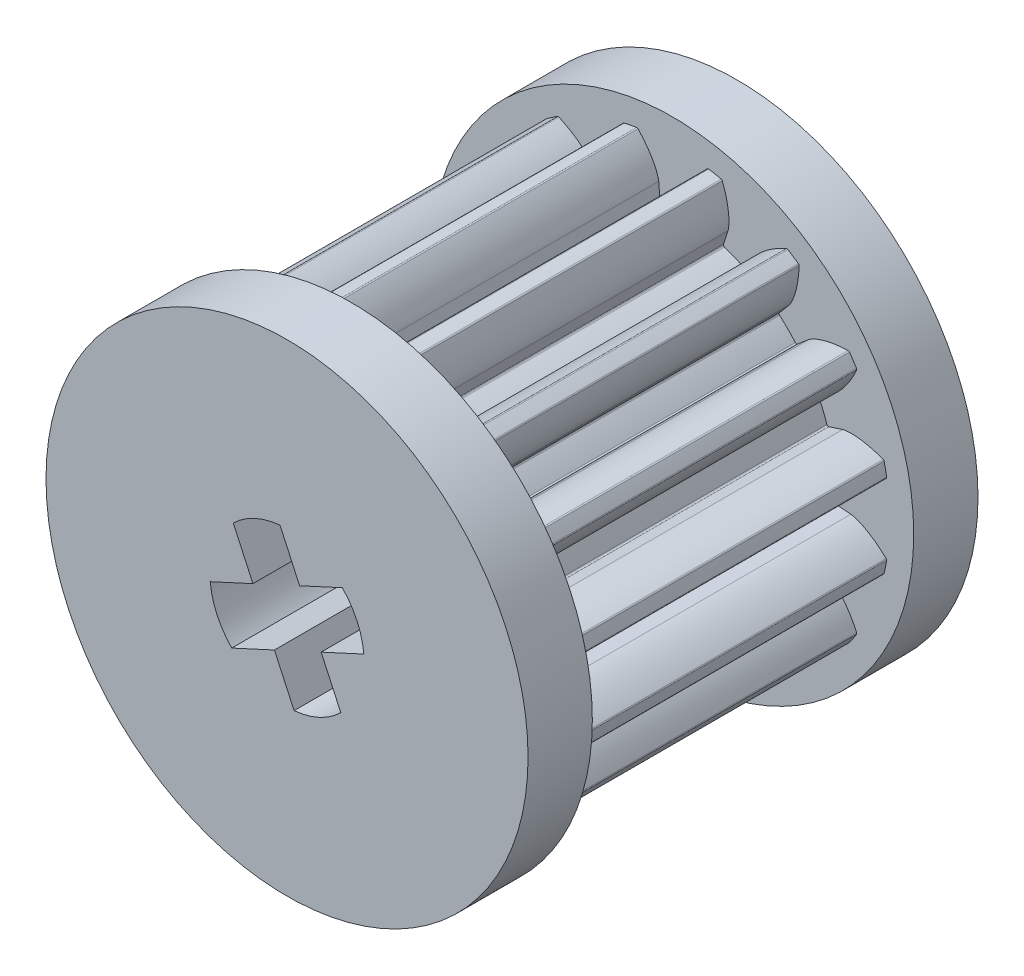
from build123d import *

# Parameters (mm, degrees)
SKETCH1_R                = 6.75
BOSS_EXTRUDE1_DEPTH      = 10
CUT_EXTRUDE3_DEPTH       = 14.824796563
FILLET2_R                = 0.05
CIRPATTERN1_COUNT        = 16
FILLET2_OF_CIRPATTERN1_R = 0.05
SKETCH6_R                = 7.5
BOSS_EXTRUDE2_DEPTH      = 2
CUT_EXTRUDE4_DEPTH       = 17.015617472
CUT_EXTRUDE4_DEPTH_BACK  = 17.015617472


with BuildPart() as part:
    # Sketch1 → Boss-Extrude1 (new body)
    with BuildSketch(Plane.XY):
        Circle(SKETCH1_R)
    extrude(amount=BOSS_EXTRUDE1_DEPTH)

    # Sketch3 → Cut-Extrude3 (cut, through all)
    with BuildSketch(Plane.XY):
        with BuildLine():
            add(Edge.make_bspline(
                [(0.434163713, 5.546135436), (0.436630111, 5.568887632), (0.447025975, 5.619389016), (0.472378991, 5.707357547), (0.514598388, 5.8199145), (0.556796354, 5.910501464), (0.584227269, 5.963693803), (0.588102842, 5.97110836)],
                knots=[0, 0, 0, 0, 0.040008387, 0.090017613, 0.160030412, 0.250046806, 0.264674884, 0.264674884, 0.264674884, 0.264674884], degree=3))
            add(Edge.make_bspline(
                [(0.588102842, 5.97110836), (0.647776123, 6.085272362), (0.763412421, 6.267141587), (0.941222365, 6.491761304), (1.047182351, 6.60848955), (1.096933403, 6.660273051)],
                knots=[0.264674884, 0.264674884, 0.264674884, 0.264674884, 0.489907489, 0.63993471, 0.765498984, 0.765498984, 0.765498984, 0.765498984], degree=3))
            ThreePointArc((1.096933403, 6.660273051), (0, 6.75), (-1.096933403, 6.660273051))
            add(Edge.make_bspline(
                [(-0.588102842, 5.97110836), (-0.647776123, 6.085272362), (-0.763412421, 6.267141587), (-0.941222365, 6.491761304), (-1.047182351, 6.60848955), (-1.096933403, 6.660273051)],
                knots=[0.264674884, 0.264674884, 0.264674884, 0.264674884, 0.489907489, 0.63993471, 0.765498984, 0.765498984, 0.765498984, 0.765498984], degree=3))
            add(Edge.make_bspline(
                [(-0.434163713, 5.546135436), (-0.436630111, 5.568887632), (-0.447025975, 5.619389016), (-0.472378991, 5.707357547), (-0.514598388, 5.8199145), (-0.556796354, 5.910501464), (-0.584227269, 5.963693803), (-0.588102842, 5.97110836)],
                knots=[0, 0, 0, 0, 0.040008387, 0.090017613, 0.160030412, 0.250046806, 0.264674884, 0.264674884, 0.264674884, 0.264674884], degree=3))
            Line((-0.434163713, 5.546135436), (-0.395094922, 5.047059169))
            ThreePointArc((-0.395094922, 5.047059169), (0, 5.0625), (0.395094922, 5.047059169))
            Line((0.395094922, 5.047059169), (0.434163713, 5.546135436))
        make_face()
    cut_extrude3 = extrude(amount=CUT_EXTRUDE3_DEPTH, mode=Mode.SUBTRACT)

    # Fillet2
    fillet2_edges = [part.edges().sort_by_distance(p)[0] for p in [
        (0.395094922, 5.047059169, 5),
        (-0.395094922, 5.047059169, 5),
        (1.096933403, 6.660273051, 5),
        (-1.096933403, 6.660273051, 5),
    ]]
    fillet(fillet2_edges, radius=FILLET2_R)

    # CirPattern1: Cut-Extrude3 ×16 about axis
    cirpattern1_axis = Axis((0, 0, 71.213492813), (0, 0, -1))
    for i in range(1, CIRPATTERN1_COUNT):
        add(cut_extrude3.rotate(cirpattern1_axis, i * 360 / CIRPATTERN1_COUNT), mode=Mode.SUBTRACT)

    # Fillet2 of CirPattern1
    fillet2_of_cirpattern1_edges = [part.edges().sort_by_distance(p)[0] for p in [
        (2.296446038, 4.511678385, 5),
        (1.566405814, 4.814070946, 5),
        (3.562210471, 5.733511713, 5),
        (1.535341832, 6.573068192, 5),
        (3.848184062, 3.289435465, 5),
        (3.289435465, 3.848184062, 5),
        (5.485173286, 3.933875191, 5),
        (3.933875191, 5.485173286, 5),
        (4.814070946, 1.566405814, 5),
        (4.511678385, 2.296446038, 5),
        (6.573068192, 1.535341832, 5),
        (5.733511713, 3.562210471, 5),
        (5.047059169, -0.395094922, 5),
        (5.047059169, 0.395094922, 5),
        (6.660273051, -1.096933403, 5),
        (6.660273051, 1.096933403, 5),
        (4.511678385, -2.296446038, 5),
        (4.814070946, -1.566405814, 5),
        (5.733511713, -3.562210471, 5),
        (6.573068192, -1.535341832, 5),
        (3.289435465, -3.848184062, 5),
        (3.848184062, -3.289435465, 5),
        (3.933875191, -5.485173286, 5),
        (5.485173286, -3.933875191, 5),
        (1.566405814, -4.814070946, 5),
        (2.296446038, -4.511678385, 5),
        (1.535341832, -6.573068192, 5),
        (3.562210471, -5.733511713, 5),
        (-0.395094922, -5.047059169, 5),
        (0.395094922, -5.047059169, 5),
        (-1.096933403, -6.660273051, 5),
        (1.096933403, -6.660273051, 5),
        (-2.296446038, -4.511678385, 5),
        (-1.566405814, -4.814070946, 5),
        (-3.562210471, -5.733511713, 5),
        (-1.535341832, -6.573068192, 5),
        (-3.848184062, -3.289435465, 5),
        (-3.289435465, -3.848184062, 5),
        (-5.485173286, -3.933875191, 5),
        (-3.933875191, -5.485173286, 5),
        (-4.814070946, -1.566405814, 5),
        (-4.511678385, -2.296446038, 5),
        (-6.573068192, -1.535341832, 5),
        (-5.733511713, -3.562210471, 5),
        (-5.047059169, 0.395094922, 5),
        (-5.047059169, -0.395094922, 5),
        (-6.660273051, 1.096933403, 5),
        (-6.660273051, -1.096933403, 5),
        (-4.511678385, 2.296446038, 5),
        (-4.814070946, 1.566405814, 5),
        (-5.733511713, 3.562210471, 5),
        (-6.573068192, 1.535341832, 5),
        (-3.289435465, 3.848184062, 5),
        (-3.848184062, 3.289435465, 5),
        (-3.933875191, 5.485173286, 5),
        (-5.485173286, 3.933875191, 5),
        (-1.566405814, 4.814070946, 5),
        (-2.296446038, 4.511678385, 5),
        (-1.535341832, 6.573068192, 5),
        (-3.562210471, 5.733511713, 5),
    ]]
    fillet(fillet2_of_cirpattern1_edges, radius=FILLET2_OF_CIRPATTERN1_R)

    # Sketch6 → Boss-Extrude2 (add)
    with BuildSketch(Plane.XY.offset(10)):
        Circle(SKETCH6_R)
    boss_extrude2 = extrude(amount=BOSS_EXTRUDE2_DEPTH)

    # Mirror1: Boss-Extrude2 across plane
    add(boss_extrude2.mirror(Plane.XY.offset(5)))

    # Sketch5 → Cut-Extrude4 (cut, two sides: drawn at the far end of the back side and taken through both)
    with BuildSketch(Plane.XY.offset(-CUT_EXTRUDE4_DEPTH_BACK)):
        with BuildLine():
            Line((-2.389910631, -0.219834432), (-1.061283325, 0.39201748))
            Line((-1.061283325, 0.39201748), (-1.673135237, 1.720644786))
            ThreePointArc((-1.673135237, 1.720644786), (-1.003898767, 2.179951207), (-0.219834432, 2.389910631))
            Line((-0.219834432, 2.389910631), (0.39201748, 1.061283325))
            Line((0.39201748, 1.061283325), (1.720644786, 1.673135237))
            ThreePointArc((1.720644786, 1.673135237), (2.179951207, 1.003898767), (2.389910631, 0.219834432))
            Line((2.389910631, 0.219834432), (1.061283325, -0.39201748))
            Line((1.061283325, -0.39201748), (1.673135237, -1.720644786))
            ThreePointArc((1.673135237, -1.720644786), (1.003898767, -2.179951207), (0.219834432, -2.389910631))
            Line((0.219834432, -2.389910631), (-0.39201748, -1.061283325))
            Line((-0.39201748, -1.061283325), (-1.720644786, -1.673135237))
            ThreePointArc((-1.720644786, -1.673135237), (-2.179951207, -1.003898767), (-2.389910631, -0.219834432))
        make_face()
    extrude(amount=CUT_EXTRUDE4_DEPTH + CUT_EXTRUDE4_DEPTH_BACK, mode=Mode.SUBTRACT)


solid = part.part
